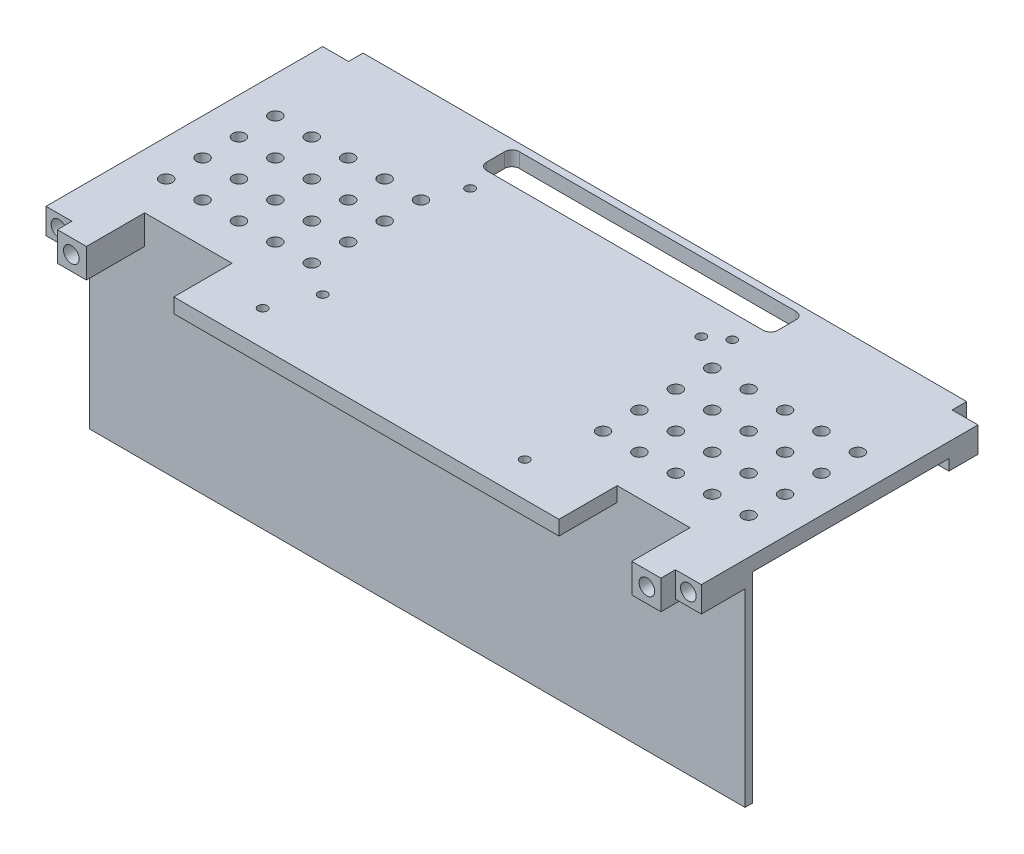
from build123d import *

# Parameters (mm, degrees)
BOSS_EXTRUDE1_DEPTH             = 4
SKETCH3_W                       = 7.1
SKETCH3_H                       = 8
BOSS_EXTRUDE3_DEPTH             = 3
SKETCH4_R                       = 2.15
CUT_EXTRUDE1_DEPTH              = 7
MIRROR2_COPY_1_SKETCH_W         = 7.1
MIRROR2_COPY_1_SKETCH_H         = 8
MIRROR2_COPY_1_DEPTH            = 3
MIRROR2_COPY_2_SKETCH_R         = 2.15
MIRROR2_COPY_2_DEPTH            = 7
SKETCH5_W                       = 80
SKETCH5_H                       = 9
CUT_EXTRUDE2_DEPTH              = 101.866248071
FILLET1_R                       = 2
SKETCH7_W                       = 165.8
SKETCH7_H                       = 1
CUT_EXTRUDE3_DEPTH              = 101.866248071
SKETCH8_W                       = 180
SKETCH8_H                       = 2
BOSS_EXTRUDE4_DEPTH             = 55
SKETCH9_W                       = 12
SKETCH9_H                       = 18
CUT_EXTRUDE4_DEPTH              = 10
SKETCH10_W                      = 7.1
SKETCH10_H                      = 4
BOSS_EXTRUDE5_DEPTH             = 3
SKETCH12_W                      = 1.5
SKETCH12_H                      = 4
BOSS_EXTRUDE6_DEPTH             = 2
SKETCH13_W                      = 90
SKETCH13_H                      = 2
BOSS_EXTRUDE7_DEPTH             = 55
SKETCH14_W                      = 1.5
SKETCH14_H                      = 4
BOSS_EXTRUDE8_DEPTH             = 1
BOSS_EXTRUDE9_REACH             = 116.285
BOSS_EXTRUDE9_DIRECTION_2_REACH = 116.285
SKETCH16_W                      = 20
SKETCH16_H                      = 14
SKETCH16_W_2                    = 14.5
SKETCH16_H_2                    = 9
BOSS_EXTRUDE10_DEPTH            = 4
SKETCH17_W                      = 12
SKETCH17_H                      = 18
CUT_EXTRUDE5_DEPTH              = 115.284732139
SKETCH18_W                      = 6
SKETCH18_H                      = 6
CUT_EXTRUDE6_DEPTH              = 117.262633722
SKETCH22_R                      = 1.25
CUT_EXTRUDE7_DEPTH              = 4
SKETCH25_W                      = 6
SKETCH25_H                      = 55
CUT_EXTRUDE11_DEPTH             = 10
CUT_EXTRUDE12_DEPTH             = 116.073889306
CUT_EXTRUDE12_DEPTH_BACK        = 116.073889306
SKETCH26_W                      = 3.576083065
SKETCH26_H                      = 29.903718591
SKETCH26_W_2                    = 12.269447076
SKETCH26_H_2                    = 28.524331859
SKETCH27_R                      = 1.25
CUT_EXTRUDE13_DEPTH             = 4
SKETCH28_W                      = 153.8
SKETCH28_H                      = 0.6
SKETCH28_W_2                    = 141.8
CUT_EXTRUDE14_DEPTH             = 117.262633722
SKETCH29_W                      = 141.8
SKETCH29_H                      = 1.4
CUT_EXTRUDE15_DEPTH             = 117.036890686
SKETCH30_W                      = 153.8
SKETCH30_H                      = 1.4
CUT_EXTRUDE16_DEPTH             = 117.036890686
SKETCH31_W                      = 2
SKETCH31_H                      = 4
CUT_EXTRUDE17_DEPTH             = 116.52056094
BOSS_EXTRUDE11_START            = -12
SKETCH32_W                      = 8
SKETCH32_H                      = 8
BOSS_EXTRUDE11_DEPTH            = 12
SKETCH33_R                      = 2.15
CUT_EXTRUDE18_DEPTH             = 10
MIRROR5_START                   = -30
MIRROR5_OUTLINE_W               = 8
MIRROR5_OUTLINE_H               = 8
MIRROR5_OUTLINE_R               = 2.15
MIRROR5_DEPTH                   = 72
MIRROR5_2_OUTLINE_R             = 2.15
MIRROR5_2_DEPTH                 = 62
SKETCH34_W                      = 20
SKETCH34_H                      = 16
CUT_EXTRUDE19_DEPTH             = 10
SKETCH35_W                      = 8
SKETCH35_H                      = 54
CUT_EXTRUDE20_DEPTH             = 4
SKETCH36_W                      = 14
SKETCH36_H                      = 6
BOSS_EXTRUDE12_DEPTH            = 1
SKETCH38_W                      = 14
SKETCH38_H                      = 6
BOSS_EXTRUDE13_DEPTH            = 3
CHAMFER1_SIZE                   = 1
SKETCH37_R                      = 1.6
CUT_EXTRUDE21_DEPTH             = 6
CHAMFER2_SIZE                   = 3
SKETCH39_W                      = 20
SKETCH39_H                      = 14
CUT_EXTRUDE22_DEPTH             = 16
SKETCH40_W                      = 16
SKETCH40_H                      = 16
CUT_EXTRUDE23_DEPTH             = 116.52056094
SKETCH41_R                      = 1.7
CUT_EXTRUDE24_DEPTH             = 4


# Read off the part's stored shape, not the designer's step: Mirror5
with BuildPart() as part:
    # Sketch1 → Boss-Extrude1 (new body)
    with BuildSketch(Plane(origin=(0, 0, 0), x_dir=(1, 0, 0), z_dir=(0, 1, 0))):
        Polygon((-90, -38), (-82.9, -38), (-82.9, -45), (82.9, -45), (82.9, -38), (90, -38), (90, 38), (82.9, 38), (82.9, 45), (-82.9, 45), (-82.9, 38), (-90, 38), align=None)
    extrude(amount=BOSS_EXTRUDE1_DEPTH)

    # Sketch3 → Boss-Extrude3 (add)
    with BuildSketch(Plane.XZ):
        with Locations((-86.45, -34)):
            Rectangle(SKETCH3_W, SKETCH3_H)
    boss_extrude3 = extrude(amount=BOSS_EXTRUDE3_DEPTH)

    # Sketch4 → Cut-Extrude1 (cut)
    with BuildSketch(Plane(origin=(0, 0, -38), x_dir=(-1, 0, 0), z_dir=(0, 0, -1))):
        with Locations((86.45, 0.5)):
            Circle(SKETCH4_R)
    cut_extrude1 = extrude(amount=-CUT_EXTRUDE1_DEPTH, mode=Mode.SUBTRACT)

    # Mirror1: Boss-Extrude3, Cut-Extrude1 across plane
    add(boss_extrude3.mirror(Plane(origin=(0, 0, 0), x_dir=(0, 0, 1), z_dir=(1, 0, 0))))
    add(cut_extrude1.mirror(Plane(origin=(0, 0, 0), x_dir=(0, 0, 1), z_dir=(1, 0, 0))), mode=Mode.SUBTRACT)

    # Mirror2: Boss-Extrude3, Cut-Extrude1 across plane
    add(boss_extrude3.mirror(Plane.XY))
    add(cut_extrude1.mirror(Plane.XY), mode=Mode.SUBTRACT)

    # Mirror2 copy 1 sketch → Mirror2 copy 1 (add)
    with BuildSketch(Plane(origin=(0, 0, 0), x_dir=(-1, 0, 0), z_dir=(0, -1, 0))):
        with Locations((-86.45, -34)):
            Rectangle(MIRROR2_COPY_1_SKETCH_W, MIRROR2_COPY_1_SKETCH_H)
    extrude(amount=MIRROR2_COPY_1_DEPTH)

    # Mirror2 copy 2 sketch → Mirror2 copy 2 (cut)
    with BuildSketch(Plane.XY.offset(38)):
        with Locations((86.45, 0.5)):
            Circle(MIRROR2_COPY_2_SKETCH_R)
    extrude(amount=-MIRROR2_COPY_2_DEPTH, mode=Mode.SUBTRACT)

    # Sketch5 → Cut-Extrude2 (cut, through all)
    with BuildSketch(Plane(origin=(0, 4, 0), x_dir=(1, 0, 0), z_dir=(0, 1, 0))):
        with Locations((0, 35.5)):
            Rectangle(SKETCH5_W, SKETCH5_H)
    extrude(amount=-CUT_EXTRUDE2_DEPTH, mode=Mode.SUBTRACT)

    # Fillet1
    fillet1_edges = [part.edges().sort_by_distance(p)[0] for p in [
        (-40, 2, -31),
        (-40, 2, -40),
        (40, 2, -40),
        (40, 2, -31),
    ]]
    fillet(fillet1_edges, radius=FILLET1_R)

    # Sketch7 → Cut-Extrude3 (cut, through all)
    with BuildSketch(Plane(origin=(0, 4, 0), x_dir=(1, 0, 0), z_dir=(0, 1, 0))):
        with Locations((0, 44.5)):
            Rectangle(SKETCH7_W, SKETCH7_H)
        with Locations((0, -44.5)):
            Rectangle(SKETCH7_W, SKETCH7_H)
    extrude(amount=-CUT_EXTRUDE3_DEPTH, mode=Mode.SUBTRACT)

    # Sketch8 → Boss-Extrude4 (add)
    with BuildSketch(Plane.XZ):
        with Locations((0, 25)):
            Rectangle(SKETCH8_W, SKETCH8_H)
    extrude(amount=BOSS_EXTRUDE4_DEPTH)

    # Sketch9 → Cut-Extrude4 (cut)
    with BuildSketch(Plane(origin=(0, 4, 0), x_dir=(1, 0, 0), z_dir=(0, 1, 0))):
        with Locations((-76.9, -35)):
            Rectangle(SKETCH9_W, SKETCH9_H)
    extrude(amount=-CUT_EXTRUDE4_DEPTH, mode=Mode.SUBTRACT)

    # Sketch10 → Boss-Extrude5 (add)
    with BuildSketch(Plane.XZ.offset(3)):
        with Locations((-86.45, 28)):
            Rectangle(SKETCH10_W, SKETCH10_H)
        with Locations((86.45, 28)):
            Rectangle(SKETCH10_W, SKETCH10_H)
    extrude(amount=-BOSS_EXTRUDE5_DEPTH)

    # Sketch12 → Boss-Extrude6 (add)
    # profile 1 of 2: a face of its own
    with BuildSketch(Plane.ZY.offset(83)):
        Polygon((26, -5.8), (26, -16.2), (28.7, -13.5), (28.7, -8.5), align=None)
        with Locations((27.35, -11)):
            Rectangle(SKETCH12_W, SKETCH12_H, mode=Mode.SUBTRACT)
    # profile 2 of 2: a face of its own
    with BuildSketch(Plane.ZY.offset(83)):
        Polygon((26, -20.8), (26, -31.2), (28.7, -28.5), (28.7, -23.5), align=None)
        with Locations((27.35, -26)):
            Rectangle(SKETCH12_W, SKETCH12_H, mode=Mode.SUBTRACT)
    boss_extrude6 = extrude(amount=-BOSS_EXTRUDE6_DEPTH)

    # Mirror3: Boss-Extrude6 across plane
    add(boss_extrude6.mirror(Plane(origin=(-76.9, 0, 0), x_dir=(0, 0, 1), z_dir=(1, 0, 0))))

    # Sketch13 → Boss-Extrude7 (add)
    with BuildSketch(Plane.XZ):
        with Locations((0, -24.5)):
            Rectangle(SKETCH13_W, SKETCH13_H)
    extrude(amount=BOSS_EXTRUDE7_DEPTH)

    # Sketch14 → Boss-Extrude8 (add, symmetric)
    # profile 1 of 2: a face of its own
    with BuildSketch(Plane(origin=(0, 0, 0), x_dir=(0, 0, -1), z_dir=(1, 0, 0))):
        Polygon((28.2, -8.5), (25.5, -5.8), (25.5, -16.2), (28.2, -13.5), align=None)
        with Locations((26.85, -11)):
            Rectangle(SKETCH14_W, SKETCH14_H, mode=Mode.SUBTRACT)
    # profile 2 of 2: a face of its own
    with BuildSketch(Plane(origin=(0, 0, 0), x_dir=(0, 0, -1), z_dir=(1, 0, 0))):
        Polygon((28.2, -28.5), (28.2, -23.5), (25.5, -20.8), (25.5, -31.2), align=None)
        with Locations((26.85, -26)):
            Rectangle(SKETCH14_W, SKETCH14_H, mode=Mode.SUBTRACT)
    extrude(amount=BOSS_EXTRUDE8_DEPTH, both=True)

    # Boss-Extrude9: up to this face of the body (flat: up to its plane)
    boss_extrude9_end = Plane(part.part.faces().sort_by_distance((-45, -27.5, -24.5))[0])
    # Sketch15 → Boss-Extrude9 (add, up to the picked face)
    with BuildSketch(Plane(origin=(0, 0, 0), x_dir=(0, 0, -1), z_dir=(1, 0, 0)), mode=Mode.PRIVATE) as boss_extrude9_sk1:
        Polygon((23.5, 0), (23.5, -5), (20.613248654, 0), align=None)
    boss_extrude9_tool1 = split(extrude(boss_extrude9_sk1.sketch, amount=-BOSS_EXTRUDE9_REACH, mode=Mode.PRIVATE), bisect_by=boss_extrude9_end, keep=Keep.BOTH, mode=Mode.PRIVATE)
    add(boss_extrude9_tool1.solids().sort_by(Axis((0, -1.666667, -22.53775), (-1, 0, 0)))[0])

    # Boss-Extrude9 direction 2: up to this face of the body (flat: up to its plane)
    boss_extrude9_direction_2_end = Plane(part.part.faces().sort_by_distance((45, -27.5, -24.5))[0])
    # Sketch15 → Boss-Extrude9 direction 2 (add, up to the picked face)
    with BuildSketch(Plane(origin=(0, 0, 0), x_dir=(0, 0, -1), z_dir=(1, 0, 0)), mode=Mode.PRIVATE) as boss_extrude9_direction_2_sk1:
        Polygon((23.5, 0), (23.5, -5), (20.613248654, 0), align=None)
    boss_extrude9_direction_2_tool1 = split(extrude(boss_extrude9_direction_2_sk1.sketch, amount=BOSS_EXTRUDE9_DIRECTION_2_REACH, mode=Mode.PRIVATE), bisect_by=boss_extrude9_direction_2_end, keep=Keep.BOTH, mode=Mode.PRIVATE)
    add(boss_extrude9_direction_2_tool1.solids().sort_by(Axis((0, -1.666667, -22.53775), (1, 0, 0)))[0])

    # Sketch16 → Boss-Extrude10 (add)
    with BuildSketch(Plane.XY.offset(44)):
        with Locations((57, -7)):
            Rectangle(SKETCH16_W, SKETCH16_H)
        with Locations((57, -7)):
            Rectangle(SKETCH16_W_2, SKETCH16_H_2, mode=Mode.SUBTRACT)
    extrude(amount=-BOSS_EXTRUDE10_DEPTH)

    # Sketch17 → Cut-Extrude5 (cut, through all)
    with BuildSketch(Plane.XZ):
        with Locations((76.9, 35)):
            Rectangle(SKETCH17_W, SKETCH17_H)
    extrude(amount=-CUT_EXTRUDE5_DEPTH, mode=Mode.SUBTRACT)

    # Sketch18 → Cut-Extrude6 (cut, through all)
    with BuildSketch(Plane(origin=(0, 4, 0), x_dir=(1, 0, 0), z_dir=(0, 1, 0))):
        with Locations((79.9, 41)):
            Rectangle(SKETCH18_W, SKETCH18_H)
        with Locations((-79.9, 41)):
            Rectangle(SKETCH18_W, SKETCH18_H)
    extrude(amount=-CUT_EXTRUDE6_DEPTH, mode=Mode.SUBTRACT)

    # Sketch22 → Cut-Extrude7 (cut)
    with BuildSketch(Plane(origin=(0, 4, 0), x_dir=(1, 0, 0), z_dir=(0, 1, 0))):
        with Locations(Location((31, 21, 0), (0, 0, 270))):
            Circle(SKETCH22_R)
        with Locations(Location((-31, -21, 0), (0, 0, 270))):
            Circle(SKETCH22_R)
    extrude(amount=-CUT_EXTRUDE7_DEPTH, mode=Mode.SUBTRACT)

    # Sketch25 → Cut-Extrude11 (cut)
    with BuildSketch(Plane(origin=(0, 0, -25.5), x_dir=(-1, 0, 0), z_dir=(0, 0, -1))):
        with Locations((-42, -27.5)):
            Rectangle(SKETCH25_W, SKETCH25_H)
        with Locations((42, -27.5)):
            Rectangle(SKETCH25_W, SKETCH25_H)
    extrude(amount=-CUT_EXTRUDE11_DEPTH, mode=Mode.SUBTRACT)

    # Sketch26 → Cut-Extrude12 (cut, two sides: drawn at the far end of the back side and taken through both)
    with BuildSketch(Plane.ZY.offset(1).offset(-CUT_EXTRUDE12_DEPTH_BACK)):
        with Locations((-27.288041533, -20.751859296)):
            Rectangle(SKETCH26_W, SKETCH26_H)
        with Locations((32.134723538, -20.06216593)):
            Rectangle(SKETCH26_W_2, SKETCH26_H_2)
    extrude(amount=CUT_EXTRUDE12_DEPTH + CUT_EXTRUDE12_DEPTH_BACK, mode=Mode.SUBTRACT)

    # Sketch27 → Cut-Extrude13 (cut)
    with BuildSketch(Plane(origin=(0, 4, 0), x_dir=(1, 0, 0), z_dir=(0, 1, 0))):
        with Locations(Location((-36, 24.5, 0), (0, 0, 270))):
            Circle(SKETCH27_R)
        with Locations(Location((-36, -32.5, 0), (0, 0, 270))):
            Circle(SKETCH27_R)
        with Locations(Location((36, -32.5, 0), (0, 0, 270))):
            Circle(SKETCH27_R)
        with Locations(Location((36, 24.5, 0), (0, 0, 270))):
            Circle(SKETCH27_R)
    extrude(amount=-CUT_EXTRUDE13_DEPTH, mode=Mode.SUBTRACT)

    # Sketch28 → Cut-Extrude14 (cut, through all)
    with BuildSketch(Plane(origin=(0, 4, 0), x_dir=(1, 0, 0), z_dir=(0, 1, 0))):
        with Locations((0, 43.7)):
            Rectangle(SKETCH28_W, SKETCH28_H)
        with Locations((0, -43.7)):
            Rectangle(SKETCH28_W_2, SKETCH28_H)
    extrude(amount=-CUT_EXTRUDE14_DEPTH, mode=Mode.SUBTRACT)

    # Sketch29 → Cut-Extrude15 (cut, through all)
    with BuildSketch(Plane(origin=(0, 4, 0), x_dir=(1, 0, 0), z_dir=(0, 1, 0))):
        with Locations((0, -42.7)):
            Rectangle(SKETCH29_W, SKETCH29_H)
    extrude(amount=-CUT_EXTRUDE15_DEPTH, mode=Mode.SUBTRACT)

    # Sketch30 → Cut-Extrude16 (cut, through all)
    with BuildSketch(Plane(origin=(0, 4, 0), x_dir=(1, 0, 0), z_dir=(0, 1, 0))):
        with Locations((0, 42.7)):
            Rectangle(SKETCH30_W, SKETCH30_H)
    extrude(amount=-CUT_EXTRUDE16_DEPTH, mode=Mode.SUBTRACT)

    # Sketch31 → Cut-Extrude17 (cut, through all)
    with BuildSketch(Plane(origin=(0, 4, 0), x_dir=(1, 0, 0), z_dir=(0, 1, 0))):
        with Locations((-75.9, 40)):
            Rectangle(SKETCH31_W, SKETCH31_H)
        with Locations((75.9, 40)):
            Rectangle(SKETCH31_W, SKETCH31_H)
    extrude(amount=-CUT_EXTRUDE17_DEPTH, mode=Mode.SUBTRACT)

    # Sketch32 → Boss-Extrude11 (add)
    with BuildSketch(Plane(origin=(0, 0, -42), x_dir=(-1, 0, 0), z_dir=(0, 0, -1)).offset(BOSS_EXTRUDE11_START)):
        with Locations((-78.9, 0)):
            Rectangle(SKETCH32_W, SKETCH32_H)
    boss_extrude11 = extrude(amount=BOSS_EXTRUDE11_DEPTH)

    # Sketch33 → Cut-Extrude18 (cut)
    with BuildSketch(Plane(origin=(0, 0, -42), x_dir=(-1, 0, 0), z_dir=(0, 0, -1))):
        with Locations((-79.05, 0)):
            Circle(SKETCH33_R)
    cut_extrude18 = extrude(amount=-CUT_EXTRUDE18_DEPTH, mode=Mode.SUBTRACT)

    # Mirror4: Boss-Extrude11, Cut-Extrude18 across plane
    add(boss_extrude11.mirror(Plane(origin=(0, 0, 0), x_dir=(0, 0, 1), z_dir=(1, 0, 0))))
    add(cut_extrude18.mirror(Plane(origin=(0, 0, 0), x_dir=(0, 0, 1), z_dir=(1, 0, 0))), mode=Mode.SUBTRACT)

    # Mirror5 outline → Mirror5 (add)
    # profile 1 of 2: a face of its own
    with BuildSketch(Plane.XY.offset(MIRROR5_START)):
        with Locations((78.9, 0)):
            Rectangle(MIRROR5_OUTLINE_W, MIRROR5_OUTLINE_H)
        with Locations((79.05, 0)):
            Circle(MIRROR5_OUTLINE_R, mode=Mode.SUBTRACT)
    # profile 2 of 2: a face of its own
    with BuildSketch(Plane.XY.offset(MIRROR5_START)):
        with Locations((-78.9, 0)):
            Rectangle(MIRROR5_OUTLINE_W, MIRROR5_OUTLINE_H)
        with Locations((-79.05, 0)):
            Circle(MIRROR5_OUTLINE_R, mode=Mode.SUBTRACT)
    extrude(amount=MIRROR5_DEPTH)

    # Mirror5 2 outline → Mirror5 2 (add)
    with BuildSketch(Plane.XY.offset(MIRROR5_START)):
        with Locations((79.05, 0)):
            Circle(MIRROR5_2_OUTLINE_R)
        with Locations((-79.05, 0)):
            Circle(MIRROR5_2_OUTLINE_R)
    extrude(amount=MIRROR5_2_DEPTH)

    # Sketch34 → Cut-Extrude19 (cut)
    with BuildSketch(Plane(origin=(0, 4, 0), x_dir=(1, 0, 0), z_dir=(0, 1, 0))):
        with Locations((-60.9, -34)):
            Rectangle(SKETCH34_W, SKETCH34_H)
    extrude(amount=-CUT_EXTRUDE19_DEPTH, mode=Mode.SUBTRACT)

    # Sketch35 → Cut-Extrude20 (cut)
    with BuildSketch(Plane.XZ.offset(4)):
        with Locations((-78.9, -3)):
            Rectangle(SKETCH35_W, SKETCH35_H)
        with Locations((78.9, -3)):
            Rectangle(SKETCH35_W, SKETCH35_H)
    extrude(amount=-CUT_EXTRUDE20_DEPTH, mode=Mode.SUBTRACT)

    # Sketch36 → Boss-Extrude12 (add)
    with BuildSketch(Plane(origin=(0, 0, -25.5), x_dir=(-1, 0, 0), z_dir=(0, 0, -1))):
        with Locations((0, -19)):
            Rectangle(SKETCH36_W, SKETCH36_H)
    extrude(amount=BOSS_EXTRUDE12_DEPTH)

    # Sketch38 → Boss-Extrude13 (add)
    with BuildSketch(Plane.XY.offset(-23.5)):
        with Locations((0, -19)):
            Rectangle(SKETCH38_W, SKETCH38_H)
    extrude(amount=BOSS_EXTRUDE13_DEPTH)

    # Chamfer1
    chamfer1_edges = [part.edges().sort_by_distance(p)[0] for p in [
        (0, -16, -25.5),
    ]]
    chamfer(chamfer1_edges, length=CHAMFER1_SIZE - 0.0001)  # a hair under: the kernel refuses the full size

    # Sketch37 → Cut-Extrude21 (cut)
    with BuildSketch(Plane(origin=(0, 0, -26.5), x_dir=(-1, 0, 0), z_dir=(0, 0, -1))):
        with Locations((-4, -19)):
            Circle(SKETCH37_R)
        with Locations((4, -19)):
            Circle(SKETCH37_R)
    extrude(amount=-CUT_EXTRUDE21_DEPTH, mode=Mode.SUBTRACT)

    # Chamfer2
    chamfer2_edges = [part.edges().sort_by_distance(p)[0] for p in [
        (0, -16, -23.5),
    ]]
    chamfer(chamfer2_edges, length=CHAMFER2_SIZE - 0.0001)  # a hair under: the kernel refuses the full size

    # Sketch39 → Cut-Extrude22 (cut)
    with BuildSketch(Plane.XY.offset(42)):
        with Locations((57, -7)):
            Rectangle(SKETCH39_W, SKETCH39_H)
    extrude(amount=-CUT_EXTRUDE22_DEPTH, mode=Mode.SUBTRACT)

    # Sketch40 → Cut-Extrude23 (cut, through all)
    with BuildSketch(Plane(origin=(0, 4, 0), x_dir=(1, 0, 0), z_dir=(0, 1, 0))):
        with Locations((62.9, -34)):
            Rectangle(SKETCH40_W, SKETCH40_H)
    extrude(amount=-CUT_EXTRUDE23_DEPTH, mode=Mode.SUBTRACT)

    # Sketch41 → Cut-Extrude24 (cut)
    with BuildSketch(Plane(origin=(0, 4, 0), x_dir=(1, 0, 0), z_dir=(0, 1, 0))):
        with Locations(Location((-80, -15, 0), (0, 0, 270))):
            Circle(SKETCH41_R)
        with Locations(Location((-70, -15, 0), (0, 0, 270))):
            Circle(SKETCH41_R)
        with Locations(Location((-60, -15, 0), (0, 0, 270))):
            Circle(SKETCH41_R)
        with Locations(Location((-50, -15, 0), (0, 0, 270))):
            Circle(SKETCH41_R)
        with Locations(Location((-40, -15, 0), (0, 0, 270))):
            Circle(SKETCH41_R)
        with Locations(Location((-70, -5, 0), (0, 0, 270))):
            Circle(SKETCH41_R)
        with Locations(Location((-60, -5, 0), (0, 0, 270))):
            Circle(SKETCH41_R)
        with Locations(Location((-50, -5, 0), (0, 0, 270))):
            Circle(SKETCH41_R)
        with Locations(Location((-40, -5, 0), (0, 0, 270))):
            Circle(SKETCH41_R)
        with Locations(Location((-70, 5, 0), (0, 0, 270))):
            Circle(SKETCH41_R)
        with Locations(Location((-60, 5, 0), (0, 0, 270))):
            Circle(SKETCH41_R)
        with Locations(Location((-50, 5, 0), (0, 0, 270))):
            Circle(SKETCH41_R)
        with Locations(Location((-40, 5, 0), (0, 0, 270))):
            Circle(SKETCH41_R)
        with Locations(Location((-70, 15, 0), (0, 0, 270))):
            Circle(SKETCH41_R)
        with Locations(Location((-60, 15, 0), (0, 0, 270))):
            Circle(SKETCH41_R)
        with Locations(Location((-50, 15, 0), (0, 0, 270))):
            Circle(SKETCH41_R)
        with Locations(Location((-40, 15, 0), (0, 0, 270))):
            Circle(SKETCH41_R)
        with Locations(Location((-80, -5, 0), (0, 0, 270))):
            Circle(SKETCH41_R)
        with Locations(Location((-80, 5, 0), (0, 0, 270))):
            Circle(SKETCH41_R)
        with Locations(Location((-80, 15, 0), (0, 0, 270))):
            Circle(SKETCH41_R)
    cut_extrude24 = extrude(amount=-CUT_EXTRUDE24_DEPTH, mode=Mode.SUBTRACT)

    # Mirror6: Cut-Extrude24 across plane
    add(cut_extrude24.mirror(Plane(origin=(0, 0, 0), x_dir=(0, 0, 1), z_dir=(1, 0, 0))), mode=Mode.SUBTRACT)


solid = part.part
